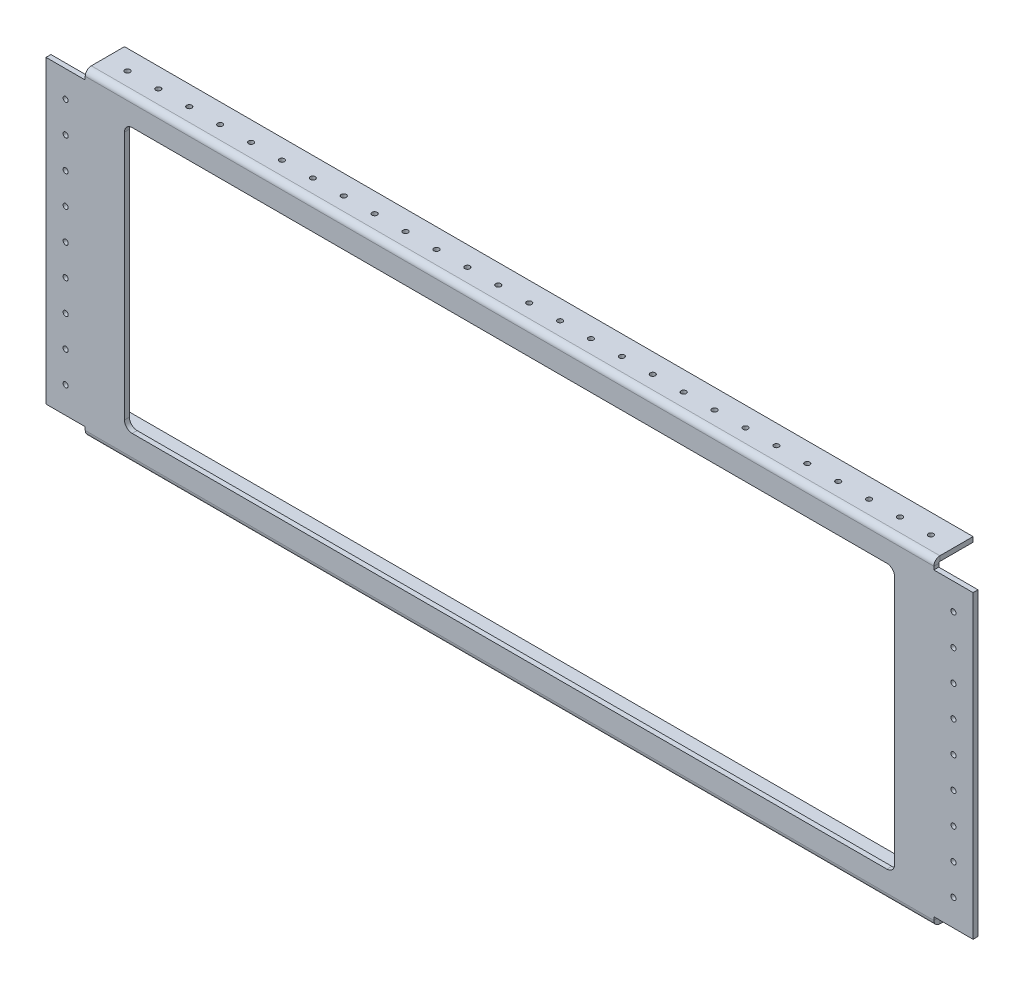
from build123d import *

# Parameters (mm, degrees)
SKETCH1_W                      = 600
SKETCH1_H                      = 206.35
BASE_FLANGE1_DEPTH             = 3.18
SKETCH6_W                      = 25.4
SKETCH6_H                      = 6
CUT_EXTRUDE1_DEPTH             = 10
EDGE_FLANGE1_STRIP_W           = 14.1932
EDGE_FLANGE1_STRIP_H           = 3.18
EDGE_FLANGE1_STRIP_CUT_DEPTH   = 549.2
EDGE_FLANGE1_STRIP_2_W         = 14.1932
EDGE_FLANGE1_STRIP_2_H         = 3.18
EDGE_FLANGE1_STRIP_CUT_2_DEPTH = 549.2
EDGE_FLANGE1_DEPTH             = 549.2
EDGE_FLANGE1_BEND_DEPTH        = 549.2
SKETCH15_W                     = 498.4
SKETCH15_H                     = 171.408066666
CUT_EXTRUDE2_DEPTH             = 10
FILLET1_R                      = 5
SKETCH16_R                     = 1.65
CUT_EXTRUDE3_DEPTH             = 10
SKETCH17_R                     = 1.65
CUT_EXTRUDE4_DEPTH             = 366.000660958


# Sheet-metal steps are written as plain solids
with BuildPart() as part:
    # Sketch1 → Base-Flange1 (new body)
    with BuildSketch(Plane.XY):
        Rectangle(SKETCH1_W, SKETCH1_H)
    extrude(amount=-BASE_FLANGE1_DEPTH)

    # Sketch6 → Cut-Extrude1 (cut)
    with BuildSketch(Plane.XY):
        with Locations((-287.3, 100.175)):
            Rectangle(SKETCH6_W, SKETCH6_H)
        with Locations((-287.3, -100.175)):
            Rectangle(SKETCH6_W, SKETCH6_H)
        with Locations((287.3, -100.175)):
            Rectangle(SKETCH6_W, SKETCH6_H)
        with Locations((287.3, 100.175)):
            Rectangle(SKETCH6_W, SKETCH6_H)
    extrude(amount=-CUT_EXTRUDE1_DEPTH, mode=Mode.SUBTRACT)

    # Edge-Flange1 strip (across the edge) → Edge-Flange1 strip cut (cut)
    with BuildSketch(Plane(origin=(-274.6, 103.175, -3.18), x_dir=(0, -1, 0), z_dir=(1, 0, 0))):
        with Locations((-3.18, -1.59)):
            Rectangle(EDGE_FLANGE1_STRIP_W, EDGE_FLANGE1_STRIP_H)
    extrude(amount=EDGE_FLANGE1_STRIP_CUT_DEPTH, mode=Mode.SUBTRACT)

    # Edge-Flange1 strip 2 (across the edge) → Edge-Flange1 strip cut 2 (cut)
    with BuildSketch(Plane(origin=(274.6, -103.175, -3.18), x_dir=(0, 1, 0), z_dir=(-1, 0, 0))):
        with Locations((-3.18, -1.59)):
            Rectangle(EDGE_FLANGE1_STRIP_2_W, EDGE_FLANGE1_STRIP_2_H)
    extrude(amount=EDGE_FLANGE1_STRIP_CUT_2_DEPTH, mode=Mode.SUBTRACT)

    # Edge-Flange1 section (across the edge) → Edge-Flange1 (add)
    with BuildSketch(Plane(origin=(-274.6, 103.175, -3.18), x_dir=(0, -1, 0), z_dir=(1, 0, 0))):
        with BuildLine():
            Line((0, 0.7366), (0, 22.22))
            Line((0, 22.22), (3.18, 22.22))
            Line((3.18, 22.22), (3.18, 0.7366))
            ThreePointArc((3.18, 0.7366), (3.395745145, 0.215745145), (3.9166, 0))
            Line((3.9166, 0), (3.9166, -3.18))
            ThreePointArc((3.9166, -3.18), (1.147145581, -2.032854419), (0, 0.7366))
        make_face()
    extrude(amount=EDGE_FLANGE1_DEPTH)

    # Edge-Flange1 section 2 (across the edge) → Edge-Flange1 bend (add)
    with BuildSketch(Plane(origin=(274.6, -103.175, -3.18), x_dir=(0, 1, 0), z_dir=(-1, 0, 0))):
        with BuildLine():
            Line((0, 0.7366), (0, 22.22))
            Line((0, 22.22), (3.18, 22.22))
            Line((3.18, 22.22), (3.18, 0.7366))
            ThreePointArc((3.18, 0.7366), (3.395745145, 0.215745145), (3.9166, 0))
            Line((3.9166, 0), (3.9166, -3.18))
            ThreePointArc((3.9166, -3.18), (1.147145581, -2.032854419), (0, 0.7366))
        make_face()
    extrude(amount=EDGE_FLANGE1_BEND_DEPTH)

    # Sketch15 → Cut-Extrude2 (cut)
    with BuildSketch(Plane.XY):
        Rectangle(SKETCH15_W, SKETCH15_H)
    extrude(amount=-CUT_EXTRUDE2_DEPTH, mode=Mode.SUBTRACT)

    # Fillet1
    fillet1_edges = [part.edges().sort_by_distance(p)[0] for p in [
        (249.2, 85.704033333, -1.59),
        (249.2, -85.704033333, -1.59),
        (-249.2, -85.704033333, -1.59),
        (-249.2, 85.704033333, -1.59),
    ]]
    fillet(fillet1_edges, radius=FILLET1_R)

    # Sketch16 → Cut-Extrude3 (cut)
    with BuildSketch(Plane.XY):
        with Locations((-287.3, 0)):
            Circle(SKETCH16_R)
        with Locations((-287.3, 20)):
            Circle(SKETCH16_R)
        with Locations((-287.3, 40)):
            Circle(SKETCH16_R)
        with Locations((-287.3, 60)):
            Circle(SKETCH16_R)
        with Locations((-287.3, -20)):
            Circle(SKETCH16_R)
        with Locations((-287.3, -40)):
            Circle(SKETCH16_R)
        with Locations((-287.3, -60)):
            Circle(SKETCH16_R)
        with Locations((287.3, -60)):
            Circle(SKETCH16_R)
        with Locations((287.3, -40)):
            Circle(SKETCH16_R)
        with Locations((287.3, -20)):
            Circle(SKETCH16_R)
        with Locations((287.3, 0)):
            Circle(SKETCH16_R)
        with Locations((287.3, 20)):
            Circle(SKETCH16_R)
        with Locations((287.3, 40)):
            Circle(SKETCH16_R)
        with Locations((287.3, 60)):
            Circle(SKETCH16_R)
        with Locations((-287.3, 80)):
            Circle(SKETCH16_R)
        with Locations((-287.3, -80)):
            Circle(SKETCH16_R)
        with Locations((287.3, -80)):
            Circle(SKETCH16_R)
        with Locations((287.3, 80)):
            Circle(SKETCH16_R)
    extrude(amount=-CUT_EXTRUDE3_DEPTH, mode=Mode.SUBTRACT)

    # Sketch17 → Cut-Extrude4 (cut, through all)
    with BuildSketch(Plane(origin=(0, 103.175, 0), x_dir=(1, 0, 0), z_dir=(0, 1, 0))):
        with Locations(Location((0, 12.7, 0), (0, 0, 270))):
            Circle(SKETCH17_R)
        with Locations(Location((20, 12.7, 0), (0, 0, 270))):
            Circle(SKETCH17_R)
        with Locations(Location((40, 12.7, 0), (0, 0, 270))):
            Circle(SKETCH17_R)
        with Locations(Location((60, 12.7, 0), (0, 0, 270))):
            Circle(SKETCH17_R)
        with Locations(Location((80, 12.7, 0), (0, 0, 270))):
            Circle(SKETCH17_R)
        with Locations(Location((100, 12.7, 0), (0, 0, 270))):
            Circle(SKETCH17_R)
        with Locations(Location((120, 12.7, 0), (0, 0, 270))):
            Circle(SKETCH17_R)
        with Locations(Location((140, 12.7, 0), (0, 0, 270))):
            Circle(SKETCH17_R)
        with Locations(Location((160, 12.7, 0), (0, 0, 270))):
            Circle(SKETCH17_R)
        with Locations(Location((180, 12.7, 0), (0, 0, 270))):
            Circle(SKETCH17_R)
        with Locations(Location((200, 12.7, 0), (0, 0, 270))):
            Circle(SKETCH17_R)
        with Locations(Location((220, 12.7, 0), (0, 0, 270))):
            Circle(SKETCH17_R)
        with Locations(Location((240, 12.7, 0), (0, 0, 270))):
            Circle(SKETCH17_R)
        with Locations(Location((260, 12.7, 0), (0, 0, 270))):
            Circle(SKETCH17_R)
        with Locations(Location((-20, 12.7, 0), (0, 0, 270))):
            Circle(SKETCH17_R)
        with Locations(Location((-40, 12.7, 0), (0, 0, 270))):
            Circle(SKETCH17_R)
        with Locations(Location((-60, 12.7, 0), (0, 0, 270))):
            Circle(SKETCH17_R)
        with Locations(Location((-80, 12.7, 0), (0, 0, 270))):
            Circle(SKETCH17_R)
        with Locations(Location((-100, 12.7, 0), (0, 0, 270))):
            Circle(SKETCH17_R)
        with Locations(Location((-120, 12.7, 0), (0, 0, 270))):
            Circle(SKETCH17_R)
        with Locations(Location((-140, 12.7, 0), (0, 0, 270))):
            Circle(SKETCH17_R)
        with Locations(Location((-160, 12.7, 0), (0, 0, 270))):
            Circle(SKETCH17_R)
        with Locations(Location((-180, 12.7, 0), (0, 0, 270))):
            Circle(SKETCH17_R)
        with Locations(Location((-200, 12.7, 0), (0, 0, 270))):
            Circle(SKETCH17_R)
        with Locations(Location((-220, 12.7, 0), (0, 0, 270))):
            Circle(SKETCH17_R)
        with Locations(Location((-240, 12.7, 0), (0, 0, 270))):
            Circle(SKETCH17_R)
        with Locations(Location((-260, 12.7, 0), (0, 0, 270))):
            Circle(SKETCH17_R)
    extrude(amount=-CUT_EXTRUDE4_DEPTH, mode=Mode.SUBTRACT)


solid = part.part
